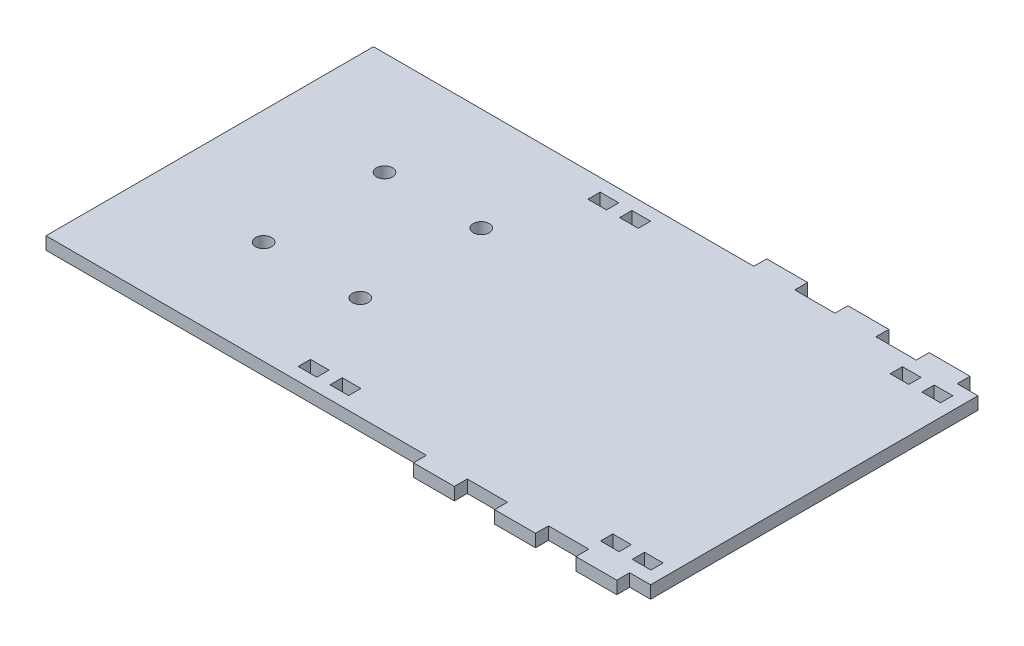
from build123d import *

# Parameters (mm, degrees)
BOSS_EXTRUDE1_DEPTH         = 3.175
SKETCH2_R                   = 2.0193
CASTER_MOUNTING_HOLES_DEPTH = 89.312530886
SKETCH3_W                   = 4.6863
SKETCH3_H                   = 3.0988
CUT_EXTRUDE1_DEPTH          = 89.312530886
LPATTERN1_COUNT             = 2
LPATTERN1_PITCH             = 76.2
LPATTERN1_COUNT_DIR2        = 2
LPATTERN1_PITCH_DIR2        = 73.025


with BuildPart() as part:
    # Sketch1 → Boss-Extrude1 (new body)
    with BuildSketch(Plane(origin=(0, 0, 0), x_dir=(1, 0, 0), z_dir=(0, 1, 0))):
        Polygon((29.9974, -41.275), (40.1574, -41.275), (40.1574, -44.5262), (50.4698, -44.5262), (50.4698, -41.275), (60.6298, -41.275), (60.6298, -44.5262), (70.9422, -44.5262), (70.9422, -41.275), (76.2, -41.275), (76.2, 41.275), (70.9422, 41.275), (70.9422, 44.5262), (60.6298, 44.5262), (60.6298, 41.275), (50.4698, 41.275), (50.4698, 44.5262), (40.1574, 44.5262), (40.1574, 41.275), (29.9974, 41.275), (29.9974, 44.5262), (19.685, 44.5262), (19.685, 41.275), (-76.2, 41.275), (-76.2, -41.275), (19.685, -41.275), (19.685, -44.5262), (29.9974, -44.5262), align=None)
    extrude(amount=BOSS_EXTRUDE1_DEPTH)

    # Sketch2 → Caster Mounting Holes (cut, through all)
    with BuildSketch(Plane(origin=(0, 3.175, 0), x_dir=(1, 0, 0), z_dir=(0, 1, 0))):
        with Locations((-47.3754273, 15.24)):
            Circle(SKETCH2_R)
        with Locations((-22.9914273, 15.24)):
            Circle(SKETCH2_R)
        with Locations((-22.9914273, -15.24)):
            Circle(SKETCH2_R)
        with Locations((-47.3754273, -15.24)):
            Circle(SKETCH2_R)
    extrude(amount=-CASTER_MOUNTING_HOLES_DEPTH, mode=Mode.SUBTRACT)

    # Sketch3 → Cut-Extrude1 (cut, through all)
    with BuildSketch(Plane(origin=(0, 3.175, 0), x_dir=(1, 0, 0), z_dir=(0, 1, 0))):
        with Locations((62.66815, 36.5506)):
            Rectangle(SKETCH3_W, SKETCH3_H)
        with Locations((70.68185, 36.5506)):
            Rectangle(SKETCH3_W, SKETCH3_H)
    cut_extrude1 = extrude(amount=-CUT_EXTRUDE1_DEPTH, mode=Mode.SUBTRACT)

    # LPattern1: Cut-Extrude1 2 × 2
    with Locations(*[(-i * LPATTERN1_PITCH, 0, j * LPATTERN1_PITCH_DIR2) for i in range(LPATTERN1_COUNT) for j in range(LPATTERN1_COUNT_DIR2) if (i, j) != (0, 0)]):
        add(cut_extrude1, mode=Mode.SUBTRACT)


solid = part.part
